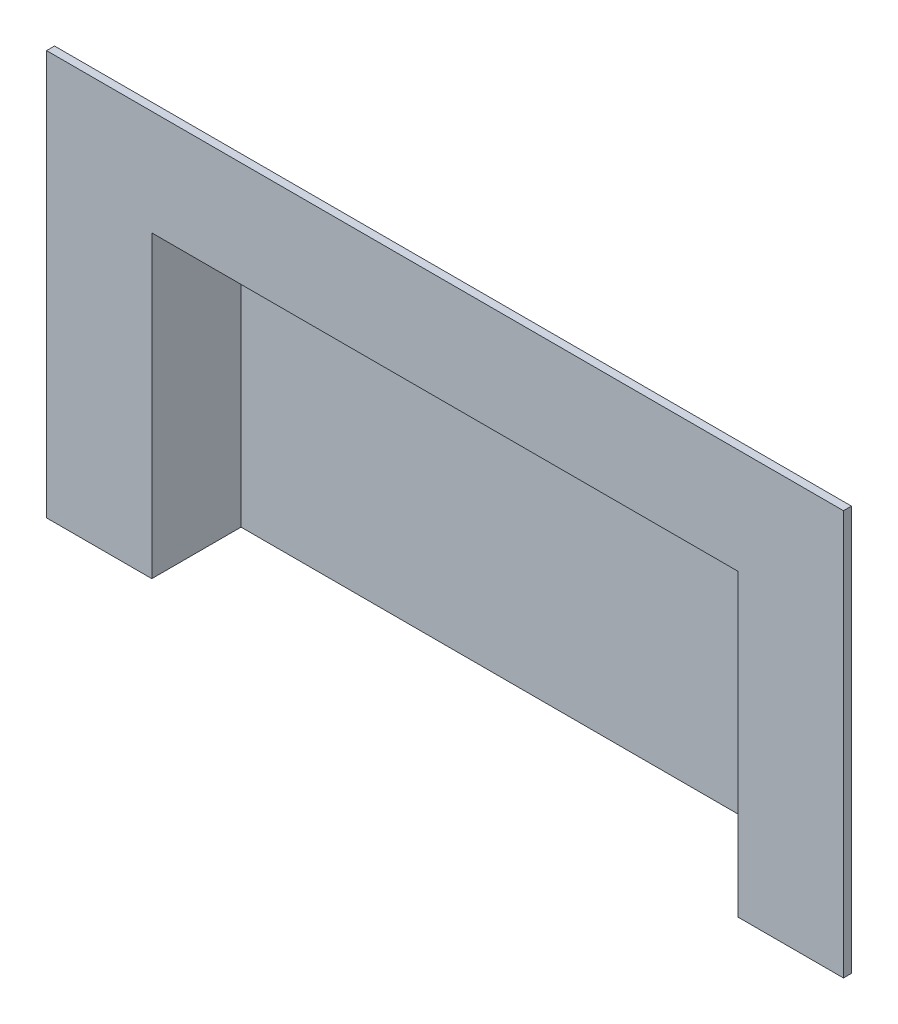
from build123d import *

# Parameters (mm, degrees)
SKETCH1_W           = 96
SKETCH1_H           = 49
BOSS_EXTRUDE1_DEPTH = 15.494
SKETCH2_W           = 127
SKETCH2_H           = 64.5
BOSS_EXTRUDE2_DEPTH = 1.27
SHELL1_START        = -46.73
SHELL1_OUTLINE_W    = 47.73
SHELL1_OUTLINE_H    = 14.224
SHELL1_DEPTH        = 93.46


# Read off the part's stored shape, not the designer's step: Shell1
with BuildPart() as part:
    # Sketch1 → Boss-Extrude1 (new body)
    with BuildSketch(Plane.XY):
        Rectangle(SKETCH1_W, SKETCH1_H)
    extrude(amount=BOSS_EXTRUDE1_DEPTH)

    # Sketch2 → Boss-Extrude2 (add)
    with BuildSketch(Plane.XY.offset(15.494)):
        with Locations((0, 7.75)):
            Rectangle(SKETCH2_W, SKETCH2_H)
    extrude(amount=-BOSS_EXTRUDE2_DEPTH)

    # Shell1 outline → Shell1 (cut)
    with BuildSketch(Plane.YZ.offset(SHELL1_START)):
        with Locations((-0.635, 8.382)):
            Rectangle(SHELL1_OUTLINE_W, SHELL1_OUTLINE_H)
    extrude(amount=SHELL1_DEPTH, mode=Mode.SUBTRACT)


solid = part.part
